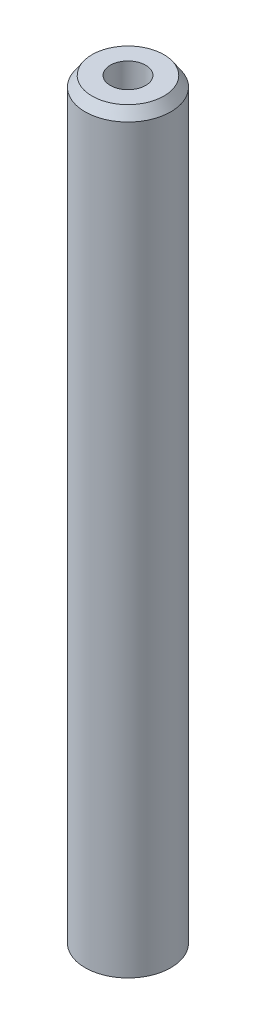
from build123d import *
from OCP.BRepFilletAPI import BRepFilletAPI_MakeChamfer

# Parameters (mm, degrees)
SKETCH1_R           = 5
BOSS_EXTRUDE1_DEPTH = 88.488245354
SKETCH2_R           = 2.058599895
CUT_EXTRUDE1_DEPTH  = 89.770319171
CHAMFER1_SIZE       = 1.187954766
CHAMFER1_SIZE2      = 0.807887738


with BuildPart() as part:
    # Sketch1 → Boss-Extrude1 (new body)
    with BuildSketch(Plane(origin=(0, 0, 0), x_dir=(1, 0, 0), z_dir=(0, 1, 0))):
        Circle(SKETCH1_R)
    extrude(amount=BOSS_EXTRUDE1_DEPTH)

    # Sketch2 → Cut-Extrude1 (cut, through all)
    with BuildSketch(Plane(origin=(0, 0, 0), x_dir=(1, 0, 0), z_dir=(0, 1, 0))):
        Circle(SKETCH2_R)
    extrude(amount=CUT_EXTRUDE1_DEPTH, mode=Mode.SUBTRACT)

    # Chamfer1: one chamfer whose edges measure the first distance from different faces: ONE call of the kernel's chamfer builder (chamfer() names one face for all edges)
    chamfer1_edges_1 = [part.edges().sort_by_distance(p)[0] for p in [
        (-5, 88.488245354, 0),
    ]]
    chamfer1_side_1 = [part.faces().sort_by_distance(p)[0] for p in [
        (-5, 44.244122677, 0),
    ]]
    chamfer1_edges_2 = [part.edges().sort_by_distance(p)[0] for p in [
        (-5, 0, 0),
    ]]
    chamfer1_side_2 = [part.faces().sort_by_distance(p)[0] for p in [
        (-4.858578644, 0, 0),
    ]]
    chamfer1 = BRepFilletAPI_MakeChamfer(part.part.solid().wrapped)
    for e in chamfer1_edges_1:
        chamfer1.Add(CHAMFER1_SIZE, CHAMFER1_SIZE2, e.wrapped, chamfer1_side_1[0].wrapped)  # the first distance lies on this face
    for e in chamfer1_edges_2:
        chamfer1.Add(CHAMFER1_SIZE, CHAMFER1_SIZE2, e.wrapped, chamfer1_side_2[0].wrapped)  # the first distance lies on this face
    add(Compound.cast(chamfer1.Shape()), mode=Mode.REPLACE)


solid = part.part
